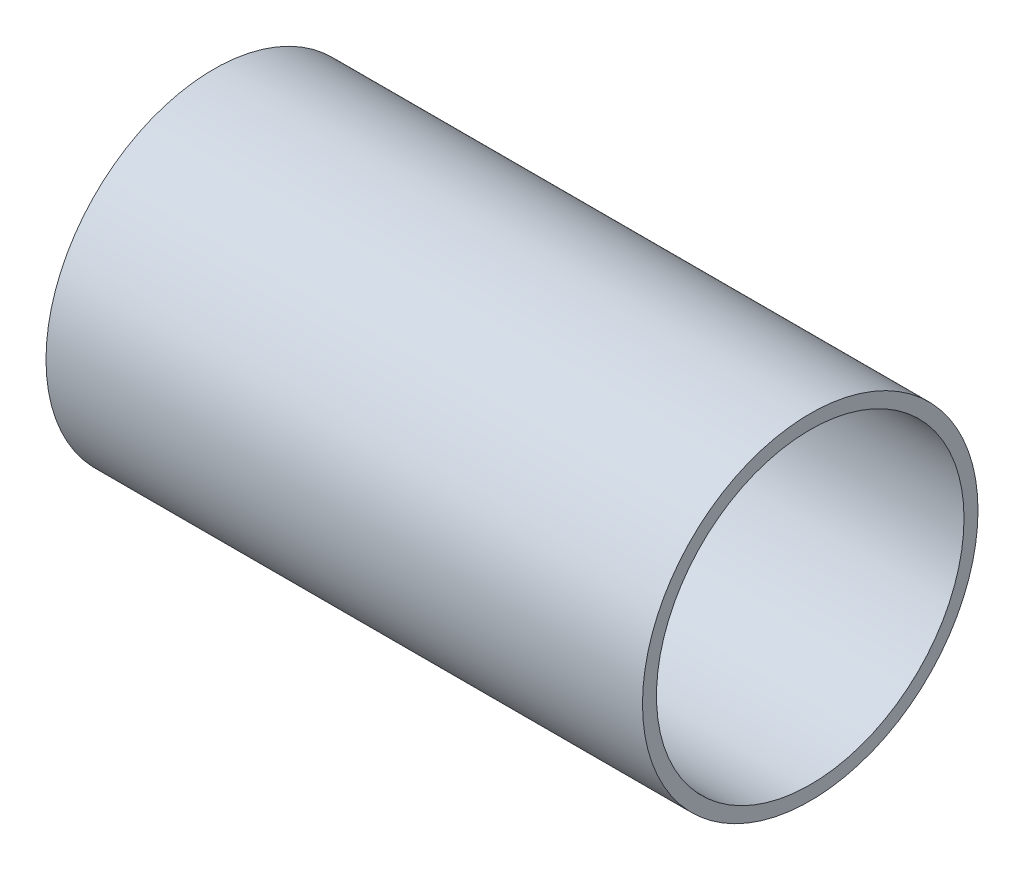
from build123d import *

# Parameters (mm, degrees)
ESBO_O2_R                = 18
RESSALTO_EXTRUS_O1_DEPTH = 64
CASCA4_T                 = -1.5


with BuildPart() as part:
    # Esboço2 → Ressalto-extrusão1 (new body)
    with BuildSketch(Plane(origin=(37, 0, 0), x_dir=(0, 0, -1), z_dir=(1, 0, 0))):
        Circle(ESBO_O2_R)
    extrude(amount=-RESSALTO_EXTRUS_O1_DEPTH)

    # Casca4
    casca4_openings = [part.faces().sort_by_distance(p)[0] for p in [
        (-27, 0, 0),
        (37, 0, 0),
    ]]
    offset(amount=CASCA4_T, openings=casca4_openings, kind=Kind.INTERSECTION)


solid = part.part
